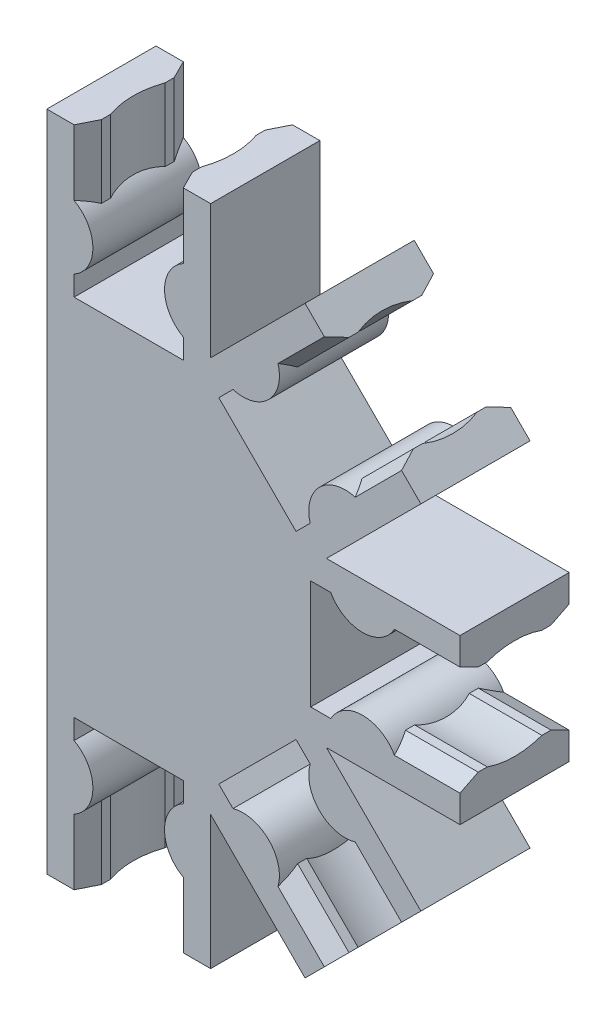
from build123d import *

# Parameters (mm, degrees)
EXTRUDE_1_DEPTH          = 6
EXTRUDE_2_REACH          = 25.907
PATTERN_CIRCULAR_1_COUNT = 5
PATTERN_CIRCULAR_1_ANGLE = 180


with BuildPart() as part:
    # 草图1 → 凸台-拉伸1 (new body)
    with BuildSketch(Plane.XY):
        with BuildLine():
            Line((-4.5, 0), (-4.5, -18.2))
            Line((-4.5, -18.2), (-3, -18.2))
            Line((-3, -18.2), (-3, -14.6))
            ThreePointArc((-3, -14.6), (-1.968245837, -12.85), (-3, -11.1))
            Line((-3, -11.1), (-3, -10))
            Line((-3, -10), (3, -10))
            Line((3, -10), (3, -11.1))
            ThreePointArc((3, -11.1), (1.968245837, -12.85), (3, -14.6))
            Line((3, -14.6), (3, -18.2))
            Line((3, -18.2), (4.5, -18.2))
            Line((4.5, -18.2), (4.5, 0))
            ThreePointArc((4.5, 0), (0, 4.5), (-4.5, 0))
        make_face()
    extrude_1 = extrude(amount=EXTRUDE_1_DEPTH)

    # 草图3 → 凸台-拉伸2 (add, up to next)
    with BuildSketch(Plane.XZ.offset(18.2), mode=Mode.PRIVATE) as extrude_2_sk1:
        with BuildLine():
            Line((-3, 6), (-3, 0))
            Line((-3, 0), (-2.5, 1))
            Line((-2.5, 1), (-2.5, 1.5))
            ThreePointArc((-2.5, 1.5), (-2.757359313, 3), (-2.5, 4.5))
            Line((-2.5, 4.5), (-2.5, 5))
            Line((-2.5, 5), (-3, 6))
        make_face()
    extrude_2_tool1 = extrude(extrude_2_sk1.sketch, amount=-EXTRUDE_2_REACH, mode=Mode.PRIVATE) - part.part
    # 草图3 → 凸台-拉伸2 (add, up to next)
    with BuildSketch(Plane.XZ.offset(18.2), mode=Mode.PRIVATE) as extrude_2_sk2:
        with BuildLine():
            Line((3, 0), (2.5, 1))
            Line((2.5, 1), (2.5, 1.5))
            ThreePointArc((2.5, 1.5), (2.757359313, 3), (2.5, 4.5))
            Line((2.5, 4.5), (2.5, 5))
            Line((2.5, 5), (3, 6))
            Line((3, 6), (3, 0))
        make_face()
    extrude_2_tool2 = extrude(extrude_2_sk2.sketch, amount=-EXTRUDE_2_REACH, mode=Mode.PRIVATE) - part.part
    extrude_2_1 = extrude_2_tool1.solids().sort_by_distance((-2.809362, -18.2, 3))[0]
    add(extrude_2_1)
    extrude_2_2 = extrude_2_tool2.solids().sort_by_distance((2.809362, -18.2, 3))[0]
    add(extrude_2_2)
    extrude_2 = extrude_2_1 + extrude_2_2  # 凸台-拉伸2 as one shape, for the pattern or mirror that repeats it

    # 阵列(圆周)1: 凸台-拉伸1, 凸台-拉伸2 ×5 about axis
    pattern_circular_1_axis = Axis((0, 0, 0), (0, 0, 1))
    add([extrude_1.rotate(pattern_circular_1_axis, i * PATTERN_CIRCULAR_1_ANGLE / (PATTERN_CIRCULAR_1_COUNT - 1)) for i in range(1, PATTERN_CIRCULAR_1_COUNT)])
    add([extrude_2.rotate(pattern_circular_1_axis, i * PATTERN_CIRCULAR_1_ANGLE / (PATTERN_CIRCULAR_1_COUNT - 1)) for i in range(1, PATTERN_CIRCULAR_1_COUNT)])


solid = part.part
